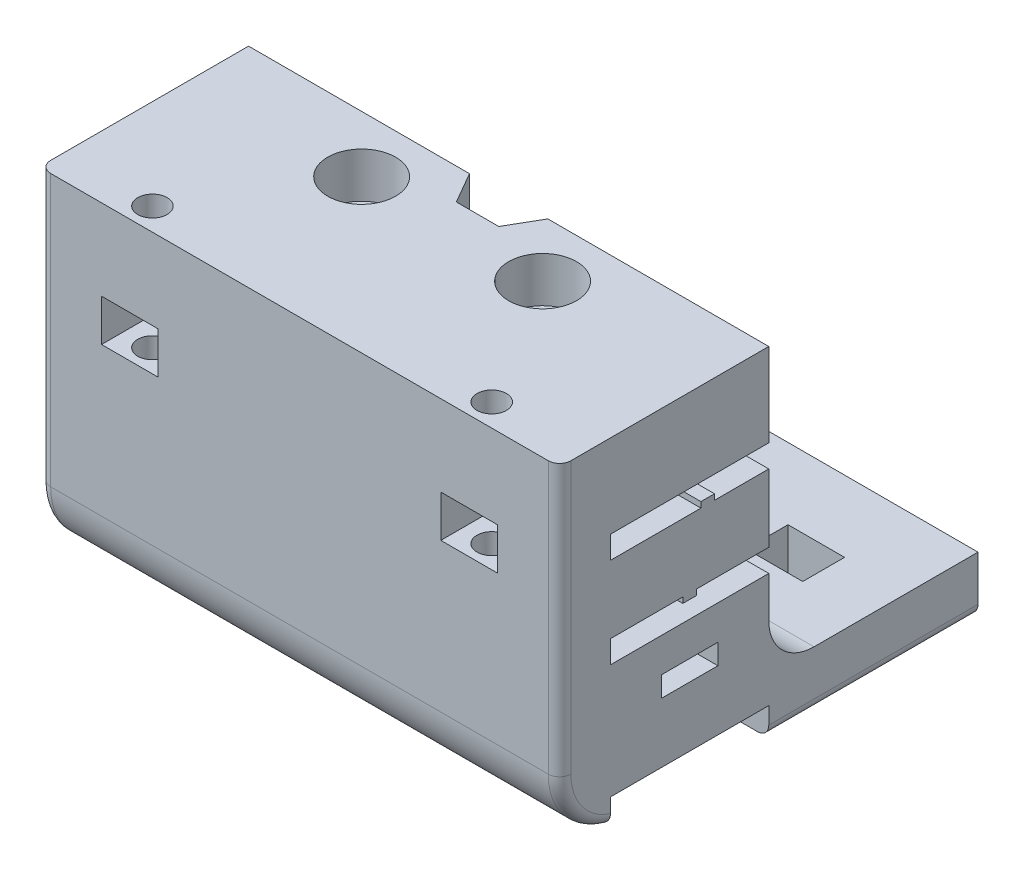
from build123d import *

# Parameters (mm, degrees)
SKETCH_1_W           = 46
SKETCH_1_H           = 30
EXTRUDE_1_DEPTH      = 3.5
SKETCH_2_W           = 46
SKETCH_2_H           = 5
EXTRUDE_2_DEPTH      = 33.5
SKETCH_4_R           = 1.3
CUT_EXTRUDE_2_DEPTH  = 15
SKETCH_5_R           = 1.3
CUT_EXTRUDE_3_DEPTH  = 15
CUT_EXTRUDE_4_REACH  = 49.71
SKETCH_6_W           = 5
SKETCH_6_H           = 3.7
SKETCH_7_W           = 46
SKETCH_7_H           = 25
EXTRUDE_3_DEPTH      = 15
SKETCH_8_W           = 46
SKETCH_8_H           = 2
CUT_EXTRUDE_5_DEPTH  = 14
SKETCH_10_W          = 5
SKETCH_10_H          = 3.7
CUT_EXTRUDE_7_DEPTH  = 5
FILLET_1_R           = 6
FILLET_2_R           = 4
SKETCH_11_W          = 5
SKETCH_11_H          = 23.135705429
CUT_EXTRUDE_8_DEPTH  = 14
FILLET_3_R           = 4
FILLET_4_R           = 1
SKETCH_12_W          = 1.2
SKETCH_12_H          = 0.5
EXTRUDE_4_DEPTH      = 10
SKETCH_13_W          = 1.2
SKETCH_13_H          = 0.5
EXTRUDE_5_DEPTH      = 10
SKETCH_14_W          = 57.080352076
SKETCH_14_H          = 14
CUT_EXTRUDE_9_DEPTH  = 2.5
FILLET_5_R           = 4
SKETCH_15_R          = 1.3
CUT_EXTRUDE_10_DEPTH = 8
SKETCH_16_W          = 5
SKETCH_16_H          = 1.8
CUT_EXTRUDE_11_DEPTH = 7
SKETCH_17_W          = 5
SKETCH_17_H          = 1.8
CUT_EXTRUDE_12_DEPTH = 7
SKETCH_18_R          = 3
CUT_EXTRUDE_13_DEPTH = 4


with BuildPart() as part:
    # Эскиз1 → Бобышка-Вытянуть1 (new body)
    with BuildSketch(Plane.XY):
        Rectangle(SKETCH_1_W, SKETCH_1_H)
    extrude(amount=EXTRUDE_1_DEPTH)

    # Эскиз2 → Бобышка-Вытянуть2 (add)
    with BuildSketch(Plane(origin=(0, 0, 0), x_dir=(-1, 0, 0), z_dir=(0, 0, -1))):
        with Locations((0, -12.5)):
            Rectangle(SKETCH_2_W, SKETCH_2_H)
    extrude(amount=EXTRUDE_2_DEPTH)

    # Эскиз4 → Вырез-Вытянуть2 (cut)
    with BuildSketch(Plane(origin=(0, 15, 0), x_dir=(1, 0, 0), z_dir=(0, 1, 0))):
        with Locations(Location((15, -1.5, 0), (0, 0, 270))):
            Circle(SKETCH_4_R)
        with Locations(Location((-15, -1.5, 0), (0, 0, 270))):
            Circle(SKETCH_4_R)
    extrude(amount=-CUT_EXTRUDE_2_DEPTH, mode=Mode.SUBTRACT)

    # Эскиз5 → Вырез-Вытянуть3 (cut)
    with BuildSketch(Plane(origin=(0, 0, -33.5), x_dir=(-1, 0, 0), z_dir=(0, 0, -1))):
        with Locations((-20, -12.5)):
            Circle(SKETCH_5_R)
        with Locations((20, -12.5)):
            Circle(SKETCH_5_R)
    extrude(amount=-CUT_EXTRUDE_3_DEPTH, mode=Mode.SUBTRACT)

    # Эскиз6 → Вырез-Вытянуть4 (cut, up to next)
    with BuildSketch(Plane(origin=(0, -10, 0), x_dir=(1, 0, 0), z_dir=(0, 1, 0)), mode=Mode.PRIVATE) as cut_extrude_4_sk1:
        with Locations((-15, 25.35)):
            Rectangle(SKETCH_6_W, SKETCH_6_H)
    cut_extrude_4_tool1 = extrude(cut_extrude_4_sk1.sketch, amount=-CUT_EXTRUDE_4_REACH, mode=Mode.PRIVATE) & part.part
    # Эскиз6 → Вырез-Вытянуть4 (cut, up to next)
    with BuildSketch(Plane(origin=(0, -10, 0), x_dir=(1, 0, 0), z_dir=(0, 1, 0)), mode=Mode.PRIVATE) as cut_extrude_4_sk2:
        with Locations((15, 25.35)):
            Rectangle(SKETCH_6_W, SKETCH_6_H)
    cut_extrude_4_tool2 = extrude(cut_extrude_4_sk2.sketch, amount=-CUT_EXTRUDE_4_REACH, mode=Mode.PRIVATE) & part.part
    add(cut_extrude_4_tool1.solids().sort_by_distance((-15, -10, -25.35))[0], mode=Mode.SUBTRACT)
    add(cut_extrude_4_tool2.solids().sort_by_distance((15, -10, -25.35))[0], mode=Mode.SUBTRACT)

    # Эскиз7 → Бобышка-Вытянуть3 (add)
    with BuildSketch(Plane(origin=(0, 0, 0), x_dir=(-1, 0, 0), z_dir=(0, 0, -1))):
        with Locations((0, 2.5)):
            Rectangle(SKETCH_7_W, SKETCH_7_H)
    extrude(amount=EXTRUDE_3_DEPTH)

    # Эскиз8 → Вырез-Вытянуть5 (cut)
    with BuildSketch(Plane(origin=(0, 0, -15), x_dir=(-1, 0, 0), z_dir=(0, 0, -1))):
        with Locations((0, 6.62)):
            Rectangle(SKETCH_8_W, SKETCH_8_H)
        with Locations((0, -1.38)):
            Rectangle(SKETCH_8_W, SKETCH_8_H)
    extrude(amount=-CUT_EXTRUDE_5_DEPTH, mode=Mode.SUBTRACT)

    # Эскиз10 → Вырез-Вытянуть7 (cut)
    with BuildSketch(Plane.XY.offset(3.5)):
        with Locations((15, 6)):
            Rectangle(SKETCH_10_W, SKETCH_10_H)
        with Locations((-15, 6)):
            Rectangle(SKETCH_10_W, SKETCH_10_H)
    extrude(amount=-CUT_EXTRUDE_7_DEPTH, mode=Mode.SUBTRACT)

    # Скругление1
    fillet_1_edges = [part.edges().sort_by_distance(p)[0] for p in [
        (0, -15, 3.5),
    ]]
    fillet(fillet_1_edges, radius=FILLET_1_R)

    # Скругление2
    fillet_2_edges = [part.edges().sort_by_distance(p)[0] for p in [
        (0, -10, -15),
    ]]
    fillet(fillet_2_edges, radius=FILLET_2_R)

    # Эскиз11 → Вырез-Вытянуть8 (cut)
    with BuildSketch(Plane(origin=(0, 0, -15), x_dir=(-1, 0, 0), z_dir=(0, 0, -1))):
        with Locations((0, -5.947852714)):
            Rectangle(SKETCH_11_W, SKETCH_11_H)
    extrude(amount=-CUT_EXTRUDE_8_DEPTH, mode=Mode.SUBTRACT)

    # Скругление3
    # the kernel refuses this fillet: 4 mm, written as the material it takes off along each edge
    with BuildSketch(Plane(origin=(-2.5, 5.62, -25), x_dir=(-1, 0, 0), z_dir=(0, 0, 1))) as fillet_3_piece_1:
        with BuildLine():
            CenterArc((FILLET_3_R, FILLET_3_R), FILLET_3_R, 180, 90)
            Line((0, FILLET_3_R), (0, 0))
            Line((0, 0), (FILLET_3_R, 0))
        make_face()
    extrude(amount=24, mode=Mode.SUBTRACT)
    with BuildSketch(Plane(origin=(-2.5, -2.38, -1), x_dir=(-1, 0, 0), z_dir=(0, 0, -1))) as fillet_3_piece_2:
        with BuildLine():
            CenterArc((FILLET_3_R, -FILLET_3_R), FILLET_3_R, 90, 90)
            Line((0, -FILLET_3_R), (0, 0))
            Line((0, 0), (FILLET_3_R, 0))
        make_face()
    extrude(amount=14, mode=Mode.SUBTRACT)
    with BuildSketch(Plane(origin=(2.5, -2.38, -15), x_dir=(0, -1, 0), z_dir=(0, 0, 1))) as fillet_3_piece_3:
        with BuildLine():
            CenterArc((FILLET_3_R, FILLET_3_R), FILLET_3_R, 180, 90)
            Line((0, FILLET_3_R), (0, 0))
            Line((0, 0), (FILLET_3_R, 0))
        make_face()
    extrude(amount=14, mode=Mode.SUBTRACT)
    with BuildSketch(Plane(origin=(2.5, 5.62, -25), x_dir=(1, 0, 0), z_dir=(0, 0, 1))) as fillet_3_piece_4:
        with BuildLine():
            CenterArc((FILLET_3_R, -FILLET_3_R), FILLET_3_R, 90, 90)
            Line((0, -FILLET_3_R), (0, 0))
            Line((0, 0), (FILLET_3_R, 0))
        make_face()
    extrude(amount=24, mode=Mode.SUBTRACT)

    # Скругление4
    fillet_4_edges = [part.edges().sort_by_distance(p)[0] for p in [
        (-23, 3, 3.5),
        (23, 3, 3.5),
        (23, -15, -18),
        (23, -13.242640687, 1.742640687),
        (-23, -15, -18),
        (-23, -13.242640687, 1.742640687),
    ]]
    fillet(fillet_4_edges, radius=FILLET_4_R)

    # Эскиз12 → Бобышка-Вытянуть4 (add)
    with BuildSketch(Plane(origin=(23, 0, 0), x_dir=(0, 0, -1), z_dir=(1, 0, 0))):
        with Locations((9.6, 5.87)):
            Rectangle(SKETCH_12_W, SKETCH_12_H)
        with Locations((8, -0.63)):
            Rectangle(SKETCH_12_W, SKETCH_12_H)
    extrude(amount=-EXTRUDE_4_DEPTH)

    # Эскиз13 → Бобышка-Вытянуть5 (add)
    with BuildSketch(Plane.ZY.offset(23)):
        with Locations((-8, 5.87)):
            Rectangle(SKETCH_13_W, SKETCH_13_H)
        with Locations((-9.6, -0.63)):
            Rectangle(SKETCH_13_W, SKETCH_13_H)
    extrude(amount=-EXTRUDE_5_DEPTH)

    # Эскиз14 → Вырез-Вытянуть9 (cut)
    with BuildSketch(Plane.XZ.offset(15)):
        with Locations((0, -8)):
            Rectangle(SKETCH_14_W, SKETCH_14_H)
    extrude(amount=-CUT_EXTRUDE_9_DEPTH, mode=Mode.SUBTRACT)

    # Скругление5
    fillet_5_edges = [part.edges().sort_by_distance(p)[0] for p in [
        (-2.5, -12.5, -8),
        (2.5, -12.5, -8),
    ]]
    fillet(fillet_5_edges, radius=FILLET_5_R)

    # Эскиз15 → Вырез-Вытянуть10 (cut)
    with BuildSketch(Plane.XZ.offset(12.5)):
        with Locations(Location((-19, -8, 0), (0, 0, 270))):
            Circle(SKETCH_15_R)
        with Locations(Location((19, -8, 0), (0, 0, 270))):
            Circle(SKETCH_15_R)
    extrude(amount=-CUT_EXTRUDE_10_DEPTH, mode=Mode.SUBTRACT)

    # Эскиз16 → Вырез-Вытянуть11 (cut)
    with BuildSketch(Plane.ZY.offset(23)):
        with Locations((-8, -6.3)):
            Rectangle(SKETCH_16_W, SKETCH_16_H)
    extrude(amount=-CUT_EXTRUDE_11_DEPTH, mode=Mode.SUBTRACT)

    # Эскиз17 → Вырез-Вытянуть12 (cut)
    with BuildSketch(Plane(origin=(23, 0, 0), x_dir=(0, 0, -1), z_dir=(1, 0, 0))):
        with Locations((8, -6.3)):
            Rectangle(SKETCH_17_W, SKETCH_17_H)
    extrude(amount=-CUT_EXTRUDE_12_DEPTH, mode=Mode.SUBTRACT)

    # Эскиз18 → Вырез-Вытянуть13 (cut)
    with BuildSketch(Plane(origin=(0, 15, 0), x_dir=(1, 0, 0), z_dir=(0, 1, 0))):
        with Locations(Location((8, 10, 0), (0, 0, 270))):
            Circle(SKETCH_18_R)
        with Locations(Location((-8, 10, 0), (0, 0, 90))):
            Circle(SKETCH_18_R)
        Polygon((3.75277675, 15.5), (1.876388375, 18.75), (-1.876388375, 18.75), (-3.75277675, 15.5), (-1.876388375, 12.25), (1.876388375, 12.25), align=None)
    extrude(amount=-CUT_EXTRUDE_13_DEPTH, mode=Mode.SUBTRACT)


solid = part.part
